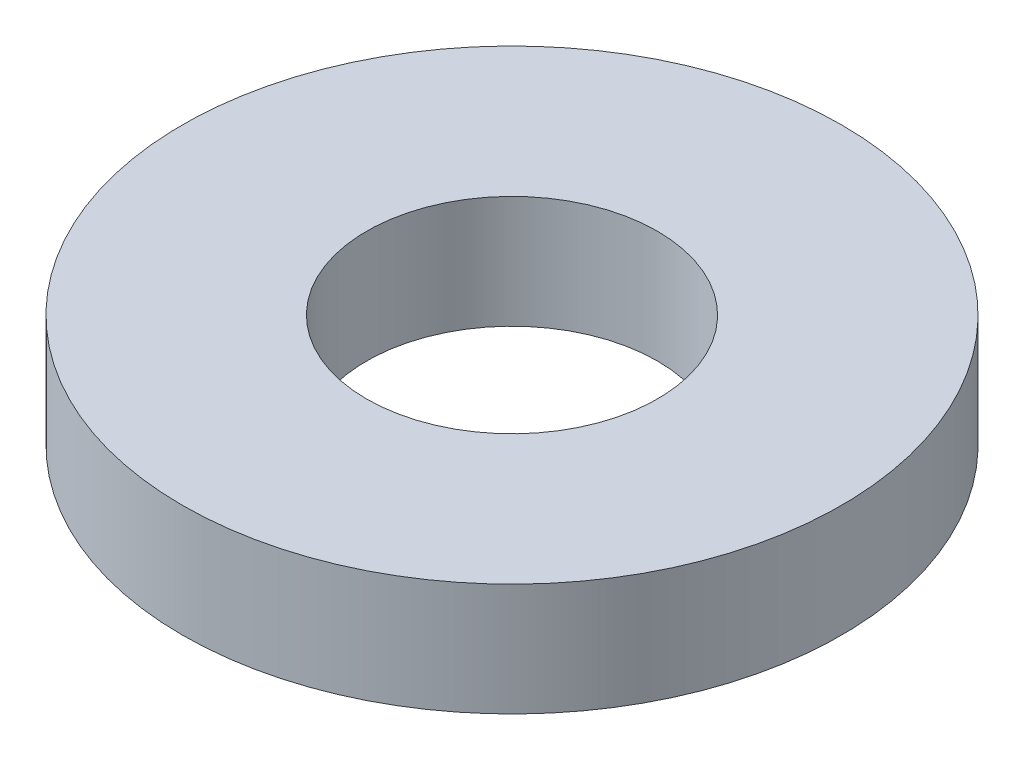
from build123d import *

# Parameters (mm, degrees)
SKETCH1_R           = 85
BOSS_EXTRUDE1_DEPTH = 29
SKETCH2_R           = 37.5
CUT_EXTRUDE1_DEPTH  = 124.656783073


with BuildPart() as part:
    # Sketch1 → Boss-Extrude1 (new body)
    with BuildSketch(Plane(origin=(0, 0, 0), x_dir=(1, 0, 0), z_dir=(0, 1, 0))):
        Circle(SKETCH1_R)
    extrude(amount=BOSS_EXTRUDE1_DEPTH)

    # Sketch2 → Cut-Extrude1 (cut, through all)
    with BuildSketch(Plane(origin=(0, 0, 0), x_dir=(1, 0, 0), z_dir=(0, 1, 0))):
        Circle(SKETCH2_R)
    extrude(amount=CUT_EXTRUDE1_DEPTH, mode=Mode.SUBTRACT)


solid = part.part
